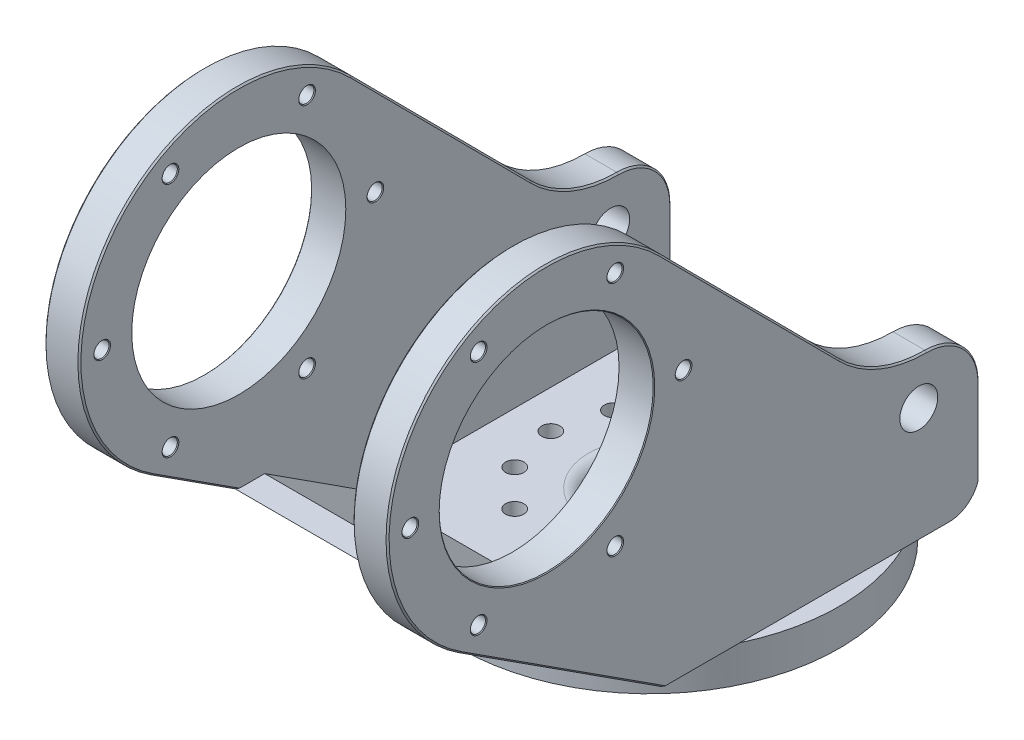
from build123d import *

# Parameters (mm, degrees)
SKETCH_1_R           = 125
EXTRUDE_1_DEPTH      = 14.5
SKETCH_3_R           = 6.000000000000002
SKETCH_3_R_2         = 6.000000000000006
SKETCH_3_R_3         = 6.000000000000149
SKETCH_3_R_4         = 6.000000000000222
SKETCH_3_R_5         = 6.000000000000299
SKETCH_3_R_6         = 6.000000000000382
SKETCH_3_R_7         = 6.000000000000431
SKETCH_3_R_8         = 6.000000000000505
SKETCH_3_R_9         = 6.000000000000598
SKETCH_3_R_10        = 6.000000000000659
SKETCH_3_R_11        = 6.00000000000077
SKETCH_3_R_12        = 6.000000000001591
CUT_EXTRUDE_1_DEPTH  = 29
SKETCH_4_OUTSIDE_W   = 322.948
SKETCH_4_OUTSIDE_H   = 322.948
SKETCH_4_OUTSIDE_W_2 = 180
SKETCH_4_OUTSIDE_H_2 = 250.00000000000003
CUT_EXTRUDE_2_DEPTH  = 5
SKETCH_5_R           = 4.999999999999991
SKETCH_5_R_2         = 4.999999999999989
SKETCH_5_R_3         = 4.9999999999999485
SKETCH_5_R_4         = 4.999999999999752
SKETCH_5_R_5         = 5.000000000000009
SKETCH_5_R_6         = 4.999999999999956
SKETCH_5_R_7         = 70.5
SKETCH_5_R_8         = 12.499999999999995
EXTRUDE_2_DEPTH      = 23
EXTRUDE_3_REACH      = 461.389
CHAMFER_1_SIZE       = 1
CHAMFER_2_SIZE       = 0.5
FILLET_1_R           = 20


with BuildPart() as part:
    # 草图1 → 凸台-拉伸1 (new, symmetric)
    with BuildSketch(Plane(origin=(0, 0, 0), x_dir=(1, 0, 0), z_dir=(0, 1, 0))):
        Circle(SKETCH_1_R)
    extrude(amount=EXTRUDE_1_DEPTH, both=True)

    # 草图2 → 切除-旋转1 (revolve, cut)
    with BuildSketch(Plane(origin=(0, 0, 0), x_dir=(0, 0, -1), z_dir=(1, 0, 0))):
        with BuildLine():
            Line((0, -14.5), (55, -14.499999999999993))
            Line((55, -14.499999999999993), (54.99999999999999, -10.499999999999991))
            Line((54.99999999999999, -10.499999999999991), (30, -10.499999999999995))
            Line((30, -10.499999999999995), (30.000000000000004, 4.50000000000003))
            ThreePointArc((30.000000000000004, 4.50000000000003), (32.92893218813453, 11.571067811865507), (40.00000000000001, 14.500000000000028))
            Line((40.00000000000001, 14.500000000000028), (0, 14.5))
            Line((0, 14.5), (0, -14.5))
        make_face()
    revolve(axis=Axis((0, -14.5, 0), (0, 1, 0)), mode=Mode.SUBTRACT)

    # 草图3 → 切除-拉伸1 (cut)
    with BuildSketch(Plane(origin=(0, 14.5, 0), x_dir=(1, 0, 0), z_dir=(0, 1, 0))):
        with Locations((0, 65)):
            Circle(SKETCH_3_R)
        with Locations((32.50000000000006, 56.291651245988476)):
            Circle(SKETCH_3_R_2)
        with Locations((56.291651245988504, 32.5)):
            Circle(SKETCH_3_R_3)
        with Locations((65, -2.5e-15)):
            Circle(SKETCH_3_R_4)
        with Locations((56.29165124598852, -32.49999999999999)):
            Circle(SKETCH_3_R_5)
        with Locations((32.50000000000001, -56.2916512459885)):
            Circle(SKETCH_3_R_6)
        with Locations((-5.01e-15, -65)):
            Circle(SKETCH_3_R_7)
        with Locations((-32.49999999999999, -56.291651245988525)):
            Circle(SKETCH_3_R_8)
        with Locations((-56.291651245988504, -32.50000000000002)):
            Circle(SKETCH_3_R_9)
        with Locations((-65, -5.46e-15)):
            Circle(SKETCH_3_R_10)
        with Locations((-56.29165124598854, 32.49999999999996)):
            Circle(SKETCH_3_R_11)
        with Locations((-32.49999999999966, 56.29165124598712)):
            Circle(SKETCH_3_R_12)
    extrude(amount=-CUT_EXTRUDE_1_DEPTH, mode=Mode.SUBTRACT)

    # 草图4 outside → 切除-拉伸2 (cut)
    with BuildSketch(Plane(origin=(0, 14.5, 0), x_dir=(1, 0, 0), z_dir=(0, 1, 0))):
        Rectangle(SKETCH_4_OUTSIDE_W, SKETCH_4_OUTSIDE_H)
        Rectangle(SKETCH_4_OUTSIDE_W_2, SKETCH_4_OUTSIDE_H_2, mode=Mode.SUBTRACT)
    extrude(amount=-CUT_EXTRUDE_2_DEPTH, mode=Mode.SUBTRACT)

    # 草图5 → 凸台-拉伸2 (add)
    with BuildSketch(Plane.ZY.offset(89.99999999999999)):
        with BuildLine():
            Line((-104.4, 9.500000000000002), (104.4, 9.500000000000002))
            Line((104.4, 9.500000000000002), (237.47000000000003, 95.3235198166396))
            ThreePointArc((237.47000000000003, 95.3235198166396), (262.1624883316829, 249.6389175912767), (106.08595480654465, 257.5809987499662))
            Line((106.08595480654465, 257.5809987499662), (-12.657997558419854, 138.10545098221195))
            ThreePointArc((-12.657997558419854, 138.10545098221195), (-38.67186892620259, 120.63673470045131), (-69.4, 114.50000000000003))
            ThreePointArc((-69.4, 114.50000000000003), (-94.14873734152917, 104.24873734152919), (-104.4, 79.50000000000001))
            Line((-104.4, 79.50000000000001), (-104.4, 9.500000000000002))
        make_face()
        with Locations((270.55983301111877, 183.56315316411926)):
            Circle(SKETCH_5_R, mode=Mode.SUBTRACT)
        with Locations((225.55983301111854, 105.6208668235197)):
            Circle(SKETCH_5_R_2, mode=Mode.SUBTRACT)
        with Locations((135.5598330111184, 105.62086682351996)):
            Circle(SKETCH_5_R_3, mode=Mode.SUBTRACT)
        with Locations((90.55983301111876, 183.56315316411926)):
            Circle(SKETCH_5_R_4, mode=Mode.SUBTRACT)
        with Locations((135.5598330111195, 261.50543950471916)):
            Circle(SKETCH_5_R_5, mode=Mode.SUBTRACT)
        with Locations((225.55983301111962, 261.50543950471825)):
            Circle(SKETCH_5_R_6, mode=Mode.SUBTRACT)
        with Locations((180.55983301111877, 183.56315316411926)):
            Circle(SKETCH_5_R_7, mode=Mode.SUBTRACT)
        with Locations((-64.4, 84.5)):
            Circle(SKETCH_5_R_8, mode=Mode.SUBTRACT)
    extrude_2 = extrude(amount=EXTRUDE_2_DEPTH)

    # 镜向1: 凸台-拉伸2 across plane
    add(extrude_2.mirror(Plane(origin=(0, 0, 0), x_dir=(0, 0, 1), z_dir=(1, 0, 0))))

    # 草图6 → 凸台-拉伸3 (add, up to next)
    with BuildSketch(Plane(origin=(-89.99999999999999, 0, 0), x_dir=(0, 0, -1), z_dir=(1, 0, 0)), mode=Mode.PRIVATE) as extrude_3_sk1:
        Polygon((-112.15253685028893, 14.499999999999998), (-93.70240648597033, 14.500000000000002), (-163.47523813857066, 59.5), (-181.9253685028892, 59.5), align=None)
    extrude_3_tool1 = extrude(extrude_3_sk1.sketch, amount=EXTRUDE_3_REACH, mode=Mode.PRIVATE) - part.part
    add(extrude_3_tool1.solids().sort_by_distance((-90, 37, 137.813887))[0])

    # 倒角1
    chamfer_1_edges = [part.edges().sort_by_distance(p)[0] for p in [
        (-1.7e-14, -10.499999999999995, 30),
        (89.99999999999999, 249.6389175912768, 262.16248833168277),
        (89.99999999999999, 44.50000000000001, -104.4),
        (89.99999999999999, 197.8432248660891, 46.71397862406239),
        (89.99999999999999, 104.24873734152919, -94.14873734152917),
        (89.99999999999999, 120.63673470045131, -38.671868926202606),
        (112.99999999999999, 52.4117599083198, 170.935),
        (112.99999999999999, 249.6389175912768, 262.16248833168277),
        (112.99999999999999, 44.50000000000001, -104.4),
        (112.99999999999999, 197.8432248660891, 46.71397862406239),
        (112.99999999999999, 104.24873734152919, -94.14873734152917),
        (112.99999999999999, 120.63673470045131, -38.671868926202606),
        (-112.99999999999999, 52.4117599083198, 170.935),
        (-112.99999999999999, 249.6389175912768, 262.16248833168277),
        (-112.99999999999999, 197.8432248660891, 46.7139786240624),
        (-112.99999999999999, 120.63673470045131, -38.671868926202606),
        (-112.99999999999999, 104.24873734152919, -94.14873734152917),
        (-112.99999999999999, 44.50000000000001, -104.4),
        (-89.99999999999999, 249.6389175912768, 262.16248833168277),
        (-89.99999999999999, 44.50000000000001, -104.4),
        (-89.99999999999999, 197.8432248660891, 46.7139786240624),
        (-89.99999999999999, 104.24873734152919, -94.14873734152917),
        (-89.99999999999999, 120.63673470045131, -38.671868926202606),
        (89.99999999999999, 77.4117599083198, 209.69768425144463),
        (-89.99999999999999, 77.4117599083198, 209.69768425144463),
    ]]
    chamfer(chamfer_1_edges, length=CHAMFER_1_SIZE)

    # 倒角2
    chamfer_2_edges = [part.edges().sort_by_distance(p)[0] for p in [
        (-89.99999999999999, 105.6208668235197, 220.55983301111854),
        (-112.99999999999999, 105.6208668235197, 220.55983301111854),
        (-89.99999999999999, 105.62086682351996, 130.55983301111846),
        (-112.99999999999999, 105.62086682351996, 130.55983301111846),
        (-89.99999999999999, 183.56315316411926, 85.559833011119),
        (-112.99999999999999, 183.56315316411926, 85.559833011119),
        (-89.99999999999999, 261.50543950471916, 130.5598330111195),
        (-112.99999999999999, 261.50543950471916, 130.5598330111195),
        (-89.99999999999999, 261.50543950471825, 220.55983301111968),
        (-112.99999999999999, 261.50543950471825, 220.55983301111968),
        (-89.99999999999999, 183.56315316411926, 265.55983301111877),
        (-112.99999999999999, 183.56315316411926, 265.55983301111877),
        (89.99999999999999, 183.56315316411926, 85.559833011119),
        (112.99999999999999, 183.56315316411926, 85.559833011119),
        (89.99999999999999, 261.50543950471916, 130.5598330111195),
        (112.99999999999999, 261.50543950471916, 130.5598330111195),
        (89.99999999999999, 261.50543950471825, 220.55983301111968),
        (112.99999999999999, 261.50543950471825, 220.55983301111968),
        (89.99999999999999, 183.56315316411926, 265.55983301111877),
        (112.99999999999999, 183.56315316411926, 265.55983301111877),
        (89.99999999999999, 105.62086682351996, 130.55983301111846),
        (112.99999999999999, 105.62086682351996, 130.55983301111846),
        (89.99999999999999, 105.6208668235197, 220.55983301111854),
        (112.99999999999999, 105.6208668235197, 220.55983301111854),
        (-112.99999999999999, 183.56315316411926, 110.05983301111877),
        (112.99999999999999, 183.56315316411926, 110.05983301111877),
    ]]
    chamfer(chamfer_2_edges, length=CHAMFER_2_SIZE)

    # 圆角1
    fillet_1_edges = [part.edges().sort_by_distance(p)[0] for p in [
        (101.49999999999999, 9.500000000000002, -104.4),
        (-101.49999999999999, 9.500000000000002, -104.4),
    ]]
    fillet(fillet_1_edges, radius=FILLET_1_R)


solid = part.part
